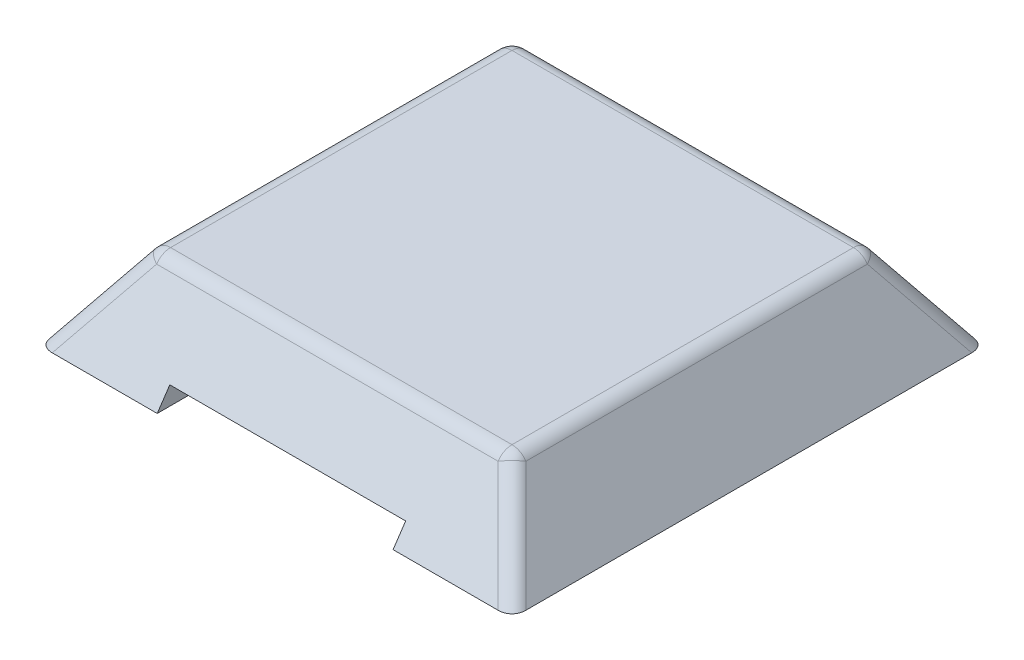
from build123d import *

# Parameters (mm, degrees)
LOFT1_OUTLINE_W     = 2132.6753346
LOFT1_OUTLINE_H     = 2132.6753346
LOFT1_DEPTH         = 500
LOFT1_DRAFT         = 34.1892347
FILLET1_R           = 100
FILLET2_R           = 100
CUT_EXTRUDE1_DEPTH  = 500
BOSS_EXTRUDE3_DEPTH = 10
SKETCH6_R           = 1005.3229303305633
BOSS_EXTRUDE4_DEPTH = 5


with BuildPart() as part:
    # Loft1: read off the stored shape, not the designer's step
    # Loft1 outline → Loft1 (with draft: the straight prism first)
    with BuildSketch(Plane(origin=(0, 500, 0), x_dir=(1, 0, 0), z_dir=(0, 1, 0))):
        Rectangle(LOFT1_OUTLINE_W, LOFT1_OUTLINE_H)
    extrude(amount=-LOFT1_DEPTH)
    # Loft1: the draft: its side faces are tilted about the plane it starts from
    loft1_sides = [part.faces().sort_by_distance(p)[0] for p in [
        (1066.3376673, 250, 0),
        (0, 250, -1066.3376673),
        (-1066.3376673, 250, 0),
        (0, 250, 1066.3376673),
    ]]
    draft(loft1_sides, Plane(origin=(0, 500, 0), x_dir=(1, 0, 0), z_dir=(0, 1, 0)), LOFT1_DRAFT)

    # Fillet1
    fillet1_edges = [part.edges().sort_by_distance(p)[0] for p in [
        (0, 500, -1066.3376673),
        (-1066.3376673, 500, 0),
        (0, 500, 1066.3376673),
        (1066.3376673, 500, 0),
    ]]
    fillet(fillet1_edges, radius=FILLET1_R)

    # Fillet2
    # the kernel refuses this fillet: 100 mm, written as the material it takes off along each edge
    with BuildSketch(Plane(origin=(-1013.3783640207519, 400, 1013.3783640207519), x_dir=(0.8421817639825007, 0.4460135945500142, -0.3029880358890411), z_dir=(-0.3411479339355868, 0.8759201871991312, 0.3411479339355868))) as fillet2_piece_1_section:
        Polygon((-149.92498415878302, -149.92498415878302), (149.92498415878302, -149.92498415878302), (149.92498415878302, 149.92498415878302), (-149.92498415878302, 149.92498415878302), align=None)
    fillet2_piece_1 = extrude(amount=149.92498415878302, mode=Mode.PRIVATE)
    fillet2_piece_1 = split(fillet2_piece_1, bisect_by=Plane(origin=(-1013.3783640207519, 400, 1013.3783640207519), z_dir=(0.4898823656610836, 0.7211314274309507, -0.4898823656610836)), keep=Keep.TOP, mode=Mode.PRIVATE)
    fillet2_piece_1 = split(fillet2_piece_1, bisect_by=Plane(origin=(-1013.3783640207519, 400, 1013.3783640207519), z_dir=(0, 0, 1)), keep=Keep.TOP, mode=Mode.PRIVATE)
    fillet2_piece_1 = split(fillet2_piece_1, bisect_by=Plane(origin=(-1013.3783640207519, 400, 1013.3783640207519), z_dir=(-1, 0, 0)), keep=Keep.TOP, mode=Mode.PRIVATE)
    fillet2_piece_1 = split(fillet2_piece_1, bisect_by=Plane(origin=(-1013.3783640207519, 456.19279678203594, 1096.09698096889), z_dir=(0, -0.5619279678203596, -0.8271861694813816)), keep=Keep.TOP, mode=Mode.PRIVATE)
    fillet2_piece_1 = split(fillet2_piece_1, bisect_by=Plane(origin=(-1096.09698096889, 456.19279678203594, 1013.3783640207519), z_dir=(0.8271861694813816, -0.5619279678203596, 0)), keep=Keep.TOP, mode=Mode.PRIVATE)
    fillet2_piece_1 = split(fillet2_piece_1, bisect_by=Plane(origin=(-1013.3783640207519, 500, 1013.3783640207519), z_dir=(0, -1, 0)), keep=Keep.TOP, mode=Mode.PRIVATE)
    fillet2_piece_1 = fillet2_piece_1 - Plane(origin=(-1013.3783640207519, 400, 1013.3783640207519), x_dir=(0.3411479339355868, -0.8759201871991312, -0.3411479339355868), z_dir=(0.8421817639825007, 0.4460135945500142, -0.3029880358890411)) * Sphere(FILLET2_R, mode=Mode.PRIVATE)
    with BuildSketch(Plane(origin=(1013.3783640207519, 400, 1013.3783640207519), x_dir=(-0.30298803588904116, 0.44601359455001427, -0.8421817639825008), z_dir=(0.3411479339355868, 0.8759201871991312, 0.3411479339355868))) as fillet2_piece_2_section:
        Polygon((-149.92498415878302, -149.92498415878302), (149.92498415878302, -149.92498415878302), (149.92498415878302, 149.92498415878302), (-149.92498415878302, 149.92498415878302), align=None)
    fillet2_piece_2 = extrude(amount=149.92498415878302, mode=Mode.PRIVATE)
    fillet2_piece_2 = split(fillet2_piece_2, bisect_by=Plane(origin=(1013.3783640207519, 400, 1013.3783640207519), z_dir=(-0.4898823656610836, 0.7211314274309507, -0.4898823656610836)), keep=Keep.TOP, mode=Mode.PRIVATE)
    fillet2_piece_2 = split(fillet2_piece_2, bisect_by=Plane(origin=(1013.3783640207519, 400, 1013.3783640207519), z_dir=(1, 0, 0)), keep=Keep.TOP, mode=Mode.PRIVATE)
    fillet2_piece_2 = split(fillet2_piece_2, bisect_by=Plane(origin=(1013.3783640207519, 400, 1013.3783640207519), z_dir=(0, 0, 1)), keep=Keep.TOP, mode=Mode.PRIVATE)
    fillet2_piece_2 = split(fillet2_piece_2, bisect_by=Plane(origin=(1096.09698096889, 456.19279678203594, 1013.3783640207519), z_dir=(-0.8271861694813816, -0.5619279678203596, 0)), keep=Keep.TOP, mode=Mode.PRIVATE)
    fillet2_piece_2 = split(fillet2_piece_2, bisect_by=Plane(origin=(1013.3783640207519, 456.19279678203594, 1096.09698096889), z_dir=(0, -0.5619279678203596, -0.8271861694813816)), keep=Keep.TOP, mode=Mode.PRIVATE)
    fillet2_piece_2 = split(fillet2_piece_2, bisect_by=Plane(origin=(1013.3783640207519, 500, 1013.3783640207519), z_dir=(0, -1, 0)), keep=Keep.TOP, mode=Mode.PRIVATE)
    fillet2_piece_2 = fillet2_piece_2 - Plane(origin=(1013.3783640207519, 400, 1013.3783640207519), x_dir=(-0.3411479339355868, -0.8759201871991312, -0.3411479339355868), z_dir=(-0.30298803588904116, 0.44601359455001427, -0.8421817639825008)) * Sphere(FILLET2_R, mode=Mode.PRIVATE)
    with BuildSketch(Plane(origin=(1013.3783640207519, 400, -1013.3783640207519), x_dir=(0.30298803588904116, -0.44601359455001427, -0.8421817639825008), z_dir=(0.3411479339355868, 0.8759201871991312, -0.3411479339355868))) as fillet2_piece_3_section:
        Polygon((-149.92498415878302, -149.92498415878302), (149.92498415878302, -149.92498415878302), (149.92498415878302, 149.92498415878302), (-149.92498415878302, 149.92498415878302), align=None)
    fillet2_piece_3 = extrude(amount=149.92498415878302, mode=Mode.PRIVATE)
    fillet2_piece_3 = split(fillet2_piece_3, bisect_by=Plane(origin=(1013.3783640207519, 400, -1013.3783640207519), z_dir=(-0.4898823656610836, 0.7211314274309507, 0.4898823656610836)), keep=Keep.TOP, mode=Mode.PRIVATE)
    fillet2_piece_3 = split(fillet2_piece_3, bisect_by=Plane(origin=(1013.3783640207519, 400, -1013.3783640207519), z_dir=(1, 0, 0)), keep=Keep.TOP, mode=Mode.PRIVATE)
    fillet2_piece_3 = split(fillet2_piece_3, bisect_by=Plane(origin=(1013.3783640207519, 400, -1013.3783640207519), z_dir=(0, 0, -1)), keep=Keep.TOP, mode=Mode.PRIVATE)
    fillet2_piece_3 = split(fillet2_piece_3, bisect_by=Plane(origin=(1096.09698096889, 456.19279678203594, -1013.3783640207519), z_dir=(-0.8271861694813816, -0.5619279678203596, 0)), keep=Keep.TOP, mode=Mode.PRIVATE)
    fillet2_piece_3 = split(fillet2_piece_3, bisect_by=Plane(origin=(1013.3783640207519, 456.19279678203594, -1096.09698096889), z_dir=(0, -0.5619279678203596, 0.8271861694813816)), keep=Keep.TOP, mode=Mode.PRIVATE)
    fillet2_piece_3 = split(fillet2_piece_3, bisect_by=Plane(origin=(1013.3783640207519, 500, -1013.3783640207519), z_dir=(0, -1, 0)), keep=Keep.TOP, mode=Mode.PRIVATE)
    fillet2_piece_3 = fillet2_piece_3 - Plane(origin=(1013.3783640207519, 400, -1013.3783640207519), x_dir=(-0.3411479339355868, -0.8759201871991312, 0.3411479339355868), z_dir=(0.30298803588904116, -0.44601359455001427, -0.8421817639825008)) * Sphere(FILLET2_R, mode=Mode.PRIVATE)
    with BuildSketch(Plane(origin=(-1013.3783640207519, 400, -1013.3783640207519), x_dir=(-0.8421817639825007, -0.4460135945500142, -0.3029880358890411), z_dir=(-0.3411479339355868, 0.8759201871991312, -0.3411479339355868))) as fillet2_piece_4_section:
        Polygon((-149.92498415878302, -149.92498415878302), (149.92498415878302, -149.92498415878302), (149.92498415878302, 149.92498415878302), (-149.92498415878302, 149.92498415878302), align=None)
    fillet2_piece_4 = extrude(amount=149.92498415878302, mode=Mode.PRIVATE)
    fillet2_piece_4 = split(fillet2_piece_4, bisect_by=Plane(origin=(-1013.3783640207519, 400, -1013.3783640207519), z_dir=(0.4898823656610836, 0.7211314274309507, 0.4898823656610836)), keep=Keep.TOP, mode=Mode.PRIVATE)
    fillet2_piece_4 = split(fillet2_piece_4, bisect_by=Plane(origin=(-1013.3783640207519, 400, -1013.3783640207519), z_dir=(0, 0, -1)), keep=Keep.TOP, mode=Mode.PRIVATE)
    fillet2_piece_4 = split(fillet2_piece_4, bisect_by=Plane(origin=(-1013.3783640207519, 400, -1013.3783640207519), z_dir=(-1, 0, 0)), keep=Keep.TOP, mode=Mode.PRIVATE)
    fillet2_piece_4 = split(fillet2_piece_4, bisect_by=Plane(origin=(-1013.3783640207519, 456.19279678203594, -1096.09698096889), z_dir=(0, -0.5619279678203596, 0.8271861694813816)), keep=Keep.TOP, mode=Mode.PRIVATE)
    fillet2_piece_4 = split(fillet2_piece_4, bisect_by=Plane(origin=(-1096.09698096889, 456.19279678203594, -1013.3783640207519), z_dir=(0.8271861694813816, -0.5619279678203596, 0)), keep=Keep.TOP, mode=Mode.PRIVATE)
    fillet2_piece_4 = split(fillet2_piece_4, bisect_by=Plane(origin=(-1013.3783640207519, 500, -1013.3783640207519), z_dir=(0, -1, 0)), keep=Keep.TOP, mode=Mode.PRIVATE)
    fillet2_piece_4 = fillet2_piece_4 - Plane(origin=(-1013.3783640207519, 400, -1013.3783640207519), x_dir=(0.3411479339355868, -0.8759201871991312, 0.3411479339355868), z_dir=(-0.8421817639825007, -0.4460135945500142, -0.3029880358890411)) * Sphere(FILLET2_R, mode=Mode.PRIVATE)
    with BuildSketch(Plane(origin=(-1076.2457758338196, 485.41476699106727, 1076.2457758338196), x_dir=(0.8717885453562122, -0.4052239175476701, 0.27527860220696176), z_dir=(-0.4898823656610837, -0.7211314274309508, 0.4898823656610837))) as fillet2_piece_5:
        with BuildLine():
            CenterArc((FILLET2_R * 0.721131427431, -FILLET2_R), FILLET2_R, 90.00000000000009, 71.5931159786692)
            Line((-FILLET2_R * 0.2277066525, -FILLET2_R * 0.684236958981), (0, 0))
            Line((0, 0), (FILLET2_R * 0.721131427431, -4.86e-15))
        make_face()
    fillet2_piece_5_solid = extrude(amount=853.4122595248351, mode=Mode.PRIVATE)
    with BuildSketch(Plane(origin=(1076.2457758338196, 485.41476699106727, 1076.2457758338196), x_dir=(0.27527860220696176, -0.4052239175476702, -0.8717885453562122), z_dir=(0.4898823656610837, -0.7211314274309508, 0.4898823656610837))) as fillet2_piece_6:
        with BuildLine():
            CenterArc((FILLET2_R * 0.721131427431, -FILLET2_R), FILLET2_R, 90.00000000000009, 71.5931159786692)
            Line((-FILLET2_R * 0.2277066525, -FILLET2_R * 0.684236958981), (0, 0))
            Line((0, 0), (FILLET2_R * 0.721131427431, -1.56e-15))
        make_face()
    fillet2_piece_6_solid = extrude(amount=853.4122595248351, mode=Mode.PRIVATE)
    with BuildSketch(Plane(origin=(1076.2457758338196, 485.41476699106727, -1076.2457758338196), x_dir=(0.27527860220696176, -0.4052239175476702, 0.8717885453562122), z_dir=(0.4898823656610837, -0.7211314274309508, -0.4898823656610837))) as fillet2_piece_7:
        with BuildLine():
            CenterArc((FILLET2_R * 0.721131427431, FILLET2_R), FILLET2_R, 198.4068840213307, 71.59311597866918)
            Line((-FILLET2_R * 0.2277066525, FILLET2_R * 0.684236958981), (0, 0))
            Line((0, 0), (FILLET2_R * 0.721131427431, 1.56e-15))
        make_face()
    fillet2_piece_7_solid = extrude(amount=853.4122595248351, mode=Mode.PRIVATE)
    with BuildSketch(Plane(origin=(-1076.2457758338196, 485.41476699106727, -1076.2457758338196), x_dir=(0.8717885453562122, -0.4052239175476701, -0.27527860220696176), z_dir=(-0.4898823656610837, -0.7211314274309508, -0.4898823656610837))) as fillet2_piece_8:
        with BuildLine():
            CenterArc((FILLET2_R * 0.721131427431, FILLET2_R), FILLET2_R, 198.4068840213307, 71.59311597866918)
            Line((-FILLET2_R * 0.2277066525, FILLET2_R * 0.684236958981), (0, 0))
            Line((0, 0), (FILLET2_R * 0.721131427431, 4.86e-15))
        make_face()
    fillet2_piece_8_solid = extrude(amount=853.4122595248351, mode=Mode.PRIVATE)
    add([fillet2_piece_1, fillet2_piece_2, fillet2_piece_3, fillet2_piece_4, fillet2_piece_5_solid, fillet2_piece_6_solid, fillet2_piece_7_solid, fillet2_piece_8_solid], mode=Mode.SUBTRACT)

    # Sketch4 → Cut-Extrude1 (cut)
    with BuildSketch(Plane.XY.offset(1012.9999999999999)):
        Polygon((700, -109.9999999999999), (-700, -110.00000000000009), (-700, 109.99999999999994), (700, 110.0000000000001), align=None)
    extrude(amount=CUT_EXTRUDE1_DEPTH, mode=Mode.SUBTRACT)

    # Sketch5 → Boss-Extrude3 (add)
    with BuildSketch(Plane.XZ):
        Polygon((-710.8706613190724, 710.8706613190723), (-404.4340828727684, 710.8706613190723), (-404.4340828727684, 110.87066131907231), (410.87066131907216, 110.87066131907231), (410.87066131907216, 710.8706613190723), (710.8706613190722, 710.8706613190723), (710.8706613190724, -710.8706613190723), (410.87066131907216, -710.8706613190723), (410.87066131907216, -110.87066131907231), (-404.4340828727684, -110.87066131907231), (-404.4340828727684, -710.8706613190723), (-710.8706613190722, -710.8706613190723), align=None)
    extrude(amount=BOSS_EXTRUDE3_DEPTH)

    # Sketch6 → Boss-Extrude4 (add)
    with BuildSketch(Plane.XZ):
        with Locations(Location((0, 0, 0), (0, 0, 135))):
            Circle(SKETCH6_R)
    extrude(amount=BOSS_EXTRUDE4_DEPTH)


solid = part.part
